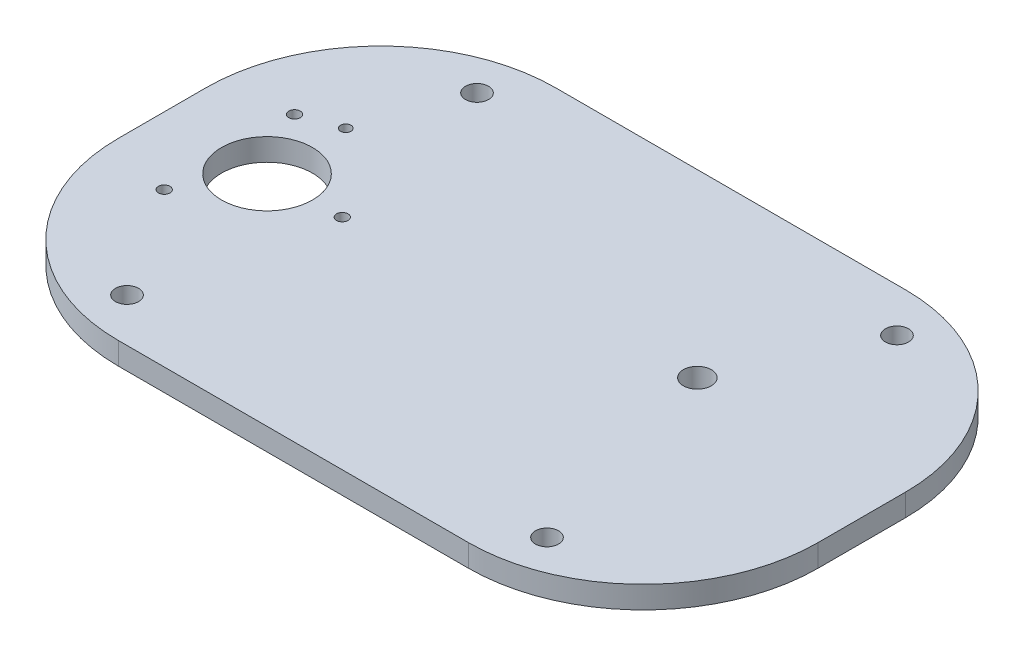
from build123d import *

# Parameters (mm, degrees)
SKETCH2_W                = 200
SKETCH2_H                = 125
SKETCH2_R                = 1.65
SKETCH2_R_2              = 13
SKETCH2_R_3              = 1.5
SKETCH2_R_4              = 4
BOSS_EXTRUDE1_DEPTH      = 6.35
FILLET1_R                = 50
M6_CLEARANCE_HOLE1_D     = 6.6
M6_CLEARANCE_HOLE1_DEPTH = 15
M6_CLEARANCE_HOLE1_TIP   = 1.982840043


with BuildPart() as part:
    # Sketch2 → Boss-Extrude1 (new body)
    with BuildSketch(Plane(origin=(0, 0, 0), x_dir=(1, 0, 0), z_dir=(0, 1, 0))):
        Rectangle(SKETCH2_W, SKETCH2_H)
        with Locations((-48.5, 0)):
            Circle(SKETCH2_R, mode=Mode.SUBTRACT)
        with Locations((-80.75, -18.619546181)):
            Circle(SKETCH2_R, mode=Mode.SUBTRACT)
        with Locations((-70, 0)):
            Circle(SKETCH2_R_2, mode=Mode.SUBTRACT)
        with Locations((-80.75, 18.619546181)):
            Circle(SKETCH2_R, mode=Mode.SUBTRACT)
        with Locations((-70, 22.5)):
            Circle(SKETCH2_R_3, mode=Mode.SUBTRACT)
        with Locations((41.960930686, 11)):
            Circle(SKETCH2_R_4, mode=Mode.SUBTRACT)
    extrude(amount=BOSS_EXTRUDE1_DEPTH)

    # Fillet1
    fillet1_edges = [part.edges().sort_by_distance(p)[0] for p in [
        (100, 3.175, 62.5),
        (100, 3.175, -62.5),
        (-100, 3.175, -62.5),
        (-100, 3.175, 62.5),
    ]]
    fillet(fillet1_edges, radius=FILLET1_R)

    # M6 Clearance Hole1
    with Locations(Plane(origin=(0, 6.35, 0), x_dir=(1, 0, 0), z_dir=(0, 1, 0))):
        with Locations((60, 50), (-60, -50), (-60, 50), (60, -50)):
            Hole(M6_CLEARANCE_HOLE1_D / 2, depth=M6_CLEARANCE_HOLE1_DEPTH)
            with Locations((0, 0, -(M6_CLEARANCE_HOLE1_DEPTH + M6_CLEARANCE_HOLE1_TIP / 2))):  # 118° drill point
                Cone(0, M6_CLEARANCE_HOLE1_D / 2, M6_CLEARANCE_HOLE1_TIP, mode=Mode.SUBTRACT)


solid = part.part
